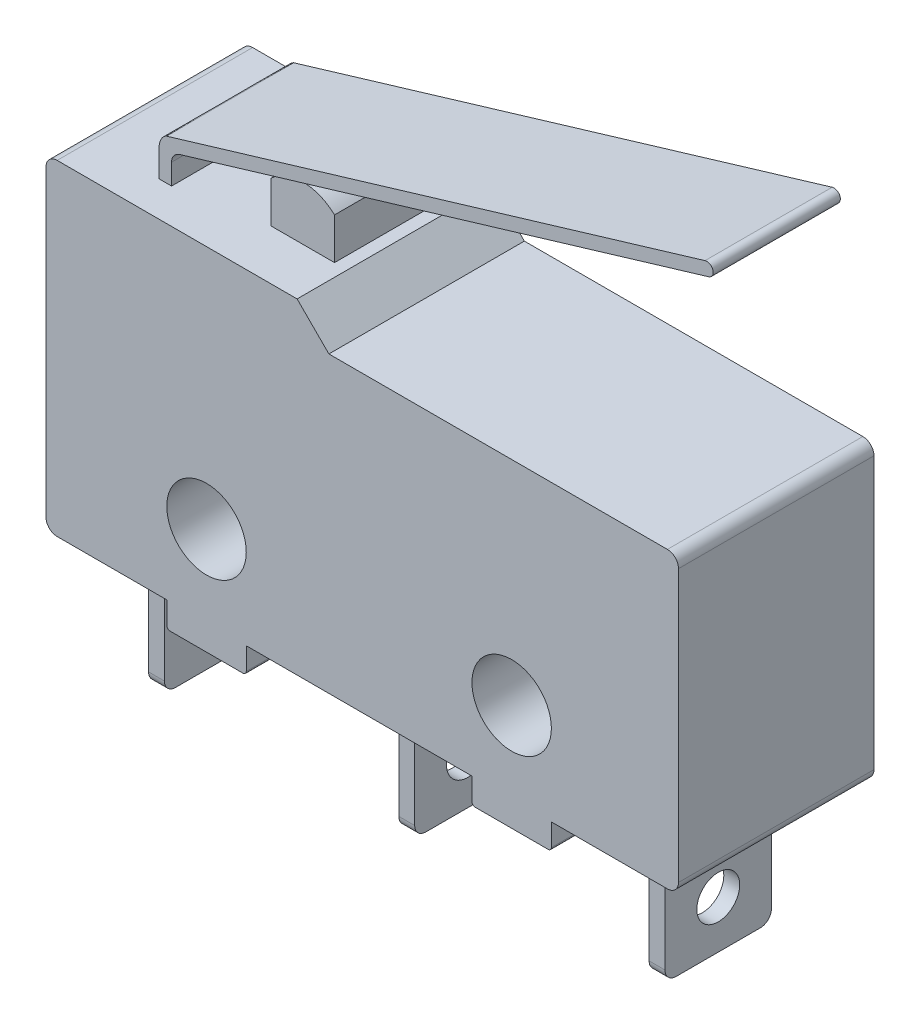
from build123d import *

# Parameters (mm, degrees)
SKETCH1_W           = 19.9
SKETCH1_H           = 10.25
BOSS_EXTRUDE1_DEPTH = 6.15
SKETCH2_W           = 12
SKETCH2_H           = 1
CUT_EXTRUDE1_DEPTH  = 6.15
FILLET1_SIZE        = 1
FILLET2_R           = 0.35
SKETCH3_W           = 2
SKETCH3_H           = 3
BOSS_EXTRUDE2_DEPTH = 1.7
CUT_EXTRUDE2_DEPTH  = 21.5
SKETCH5_R           = 1.25
CUT_EXTRUDE3_DEPTH  = 21.5
SKETCH6_W           = 2.5
SKETCH6_H           = 0.8
BOSS_EXTRUDE3_DEPTH = 6.15
FILLET3_R           = 0.1
SKETCH7_W           = 0.5
SKETCH7_H           = 3.35
BOSS_EXTRUDE4_DEPTH = 4
SKETCH8_R           = 0.675
CUT_EXTRUDE4_DEPTH  = 44
FILLET4_R           = 0.35
BOSS_EXTRUDE5_START = -1.1
SKETCH9_W           = 0.4
SKETCH9_H           = 1
BOSS_EXTRUDE5_DEPTH = 4
CUT_EXTRUDE7_DEPTH  = 24
FILLET6_R           = 0.35


with BuildPart() as part:
    # Sketch1 → Boss-Extrude1 (new body)
    with BuildSketch(Plane.XY):
        with Locations((9.95, 5.125)):
            Rectangle(SKETCH1_W, SKETCH1_H)
    extrude(amount=BOSS_EXTRUDE1_DEPTH)

    # Sketch2 → Cut-Extrude1 (cut)
    with BuildSketch(Plane.XY.offset(6.15)):
        with Locations((13.9, 9.75)):
            Rectangle(SKETCH2_W, SKETCH2_H)
    extrude(amount=-CUT_EXTRUDE1_DEPTH, mode=Mode.SUBTRACT)

    # Fillet1
    fillet1_edges = [part.edges().sort_by_distance(p)[0] for p in [
        (7.9, 9.25, 3.075),
    ]]
    chamfer(fillet1_edges, length=FILLET1_SIZE - 0.0001)  # a hair under: the kernel refuses the full size

    # Fillet2
    fillet2_edges = [part.edges().sort_by_distance(p)[0] for p in [
        (19.9, 9.25, 3.075),
        (0, 10.25, 3.075),
        (19.9, 0, 3.075),
        (0, 0, 3.075),
    ]]
    fillet(fillet2_edges, radius=FILLET2_R)

    # Sketch3 → Boss-Extrude2 (add)
    with BuildSketch(Plane(origin=(0, 10.25, 0), x_dir=(1, 0, 0), z_dir=(0, 1, 0))):
        with Locations((6.5, -3.072396368)):
            Rectangle(SKETCH3_W, SKETCH3_H)
    extrude(amount=BOSS_EXTRUDE2_DEPTH)

    # Sketch4 → Cut-Extrude2 (cut)
    with BuildSketch(Plane.XY.offset(4.572396368)):
        with BuildLine():
            Line((5.5, 11.95), (5.5, 11.55))
            ThreePointArc((5.5, 11.55), (5.961483519, 11.846291202), (6.5, 11.95))
            Line((6.5, 11.95), (5.5, 11.95))
        make_face()
        with BuildLine():
            Line((7.5, 11.95), (6.5, 11.95))
            ThreePointArc((6.5, 11.95), (7.038516481, 11.846291202), (7.5, 11.55))
            Line((7.5, 11.55), (7.5, 11.95))
        make_face()
    extrude(amount=-CUT_EXTRUDE2_DEPTH, mode=Mode.SUBTRACT)

    # Sketch5 → Cut-Extrude3 (cut)
    with BuildSketch(Plane.XY.offset(6.15)):
        with Locations((5.05, 2.55)):
            Circle(SKETCH5_R)
        with Locations((14.65, 2.55)):
            Circle(SKETCH5_R)
    extrude(amount=-CUT_EXTRUDE3_DEPTH, mode=Mode.SUBTRACT)

    # Sketch6 → Boss-Extrude3 (add)
    with BuildSketch(Plane.XY.offset(6.15)):
        with Locations((5.05, -0.4)):
            Rectangle(SKETCH6_W, SKETCH6_H)
        with Locations((14.65, -0.4)):
            Rectangle(SKETCH6_W, SKETCH6_H)
    extrude(amount=-BOSS_EXTRUDE3_DEPTH)

    # Fillet3
    fillet3_edges = [part.edges().sort_by_distance(p)[0] for p in [
        (15.9, -0.8, 3.075),
        (13.4, -0.8, 3.075),
        (6.3, -0.8, 3.075),
        (3.8, -0.8, 3.075),
    ]]
    fillet(fillet3_edges, radius=FILLET3_R)

    # Sketch7 → Boss-Extrude4 (add)
    with BuildSketch(Plane.XZ):
        with Locations((2.075, 3.075)):
            Rectangle(SKETCH7_W, SKETCH7_H)
        with Locations((17.825, 3.075)):
            Rectangle(SKETCH7_W, SKETCH7_H)
        with Locations((9.95, 3.075)):
            Rectangle(SKETCH7_W, SKETCH7_H)
    extrude(amount=BOSS_EXTRUDE4_DEPTH)

    # Sketch8 → Cut-Extrude4 (cut)
    with BuildSketch(Plane.ZY.offset(-1.825)):
        with Locations((3.075, -2.5)):
            Circle(SKETCH8_R)
    extrude(amount=-CUT_EXTRUDE4_DEPTH, mode=Mode.SUBTRACT)

    # Fillet4
    fillet4_edges = [part.edges().sort_by_distance(p)[0] for p in [
        (2.075, -4, 1.4),
        (2.075, -4, 4.75),
        (17.825, -4, 4.75),
        (17.825, -4, 1.4),
        (9.95, -4, 4.75),
        (9.95, -4, 1.4),
    ]]
    fillet(fillet4_edges, radius=FILLET4_R)

    # Sketch9 → Boss-Extrude5 (add)
    with BuildSketch(Plane.XY.offset(6.15).offset(BOSS_EXTRUDE5_START)):
        with Locations((2.65, 10.75)):
            Rectangle(SKETCH9_W, SKETCH9_H)
        with BuildLine():
            Line((2.392566175, 11.441575979), (19.634404289, 16.61062023))
            ThreePointArc((19.634404289, 16.61062023), (19.883414093, 16.476478076), (19.749271939, 16.227468271))
            Line((19.749271939, 16.227468271), (2.507433825, 11.058424021))
            ThreePointArc((2.507433825, 11.058424021), (2.258424021, 11.192566175), (2.392566175, 11.441575979))
        make_face()
    extrude(amount=-BOSS_EXTRUDE5_DEPTH)

    # Sketch12 → Cut-Extrude7 (cut)
    with BuildSketch(Plane.XY.offset(5.05)):
        with BuildLine():
            Line((2.392566175, 11.441575979), (2.692202246, 11.531405851))
            add(Edge.make_bspline(
                [(2.45, 11.05), (2.461499925, 11.421364666), (2.692202246, 11.531405851)],
                knots=[0, 0, 0, 0.800009839, 0.800009839, 0.800009839], degree=2))
            ThreePointArc((2.45, 11.05), (2.252117212, 11.220975836), (2.392566175, 11.441575979))
        make_face()
    extrude(amount=-CUT_EXTRUDE7_DEPTH, mode=Mode.SUBTRACT)

    # Fillet6
    fillet6_edges = [part.edges().sort_by_distance(p)[0] for p in [
        (2.85, 11.161124192, 3.05),
    ]]
    fillet(fillet6_edges, radius=FILLET6_R)


solid = part.part
